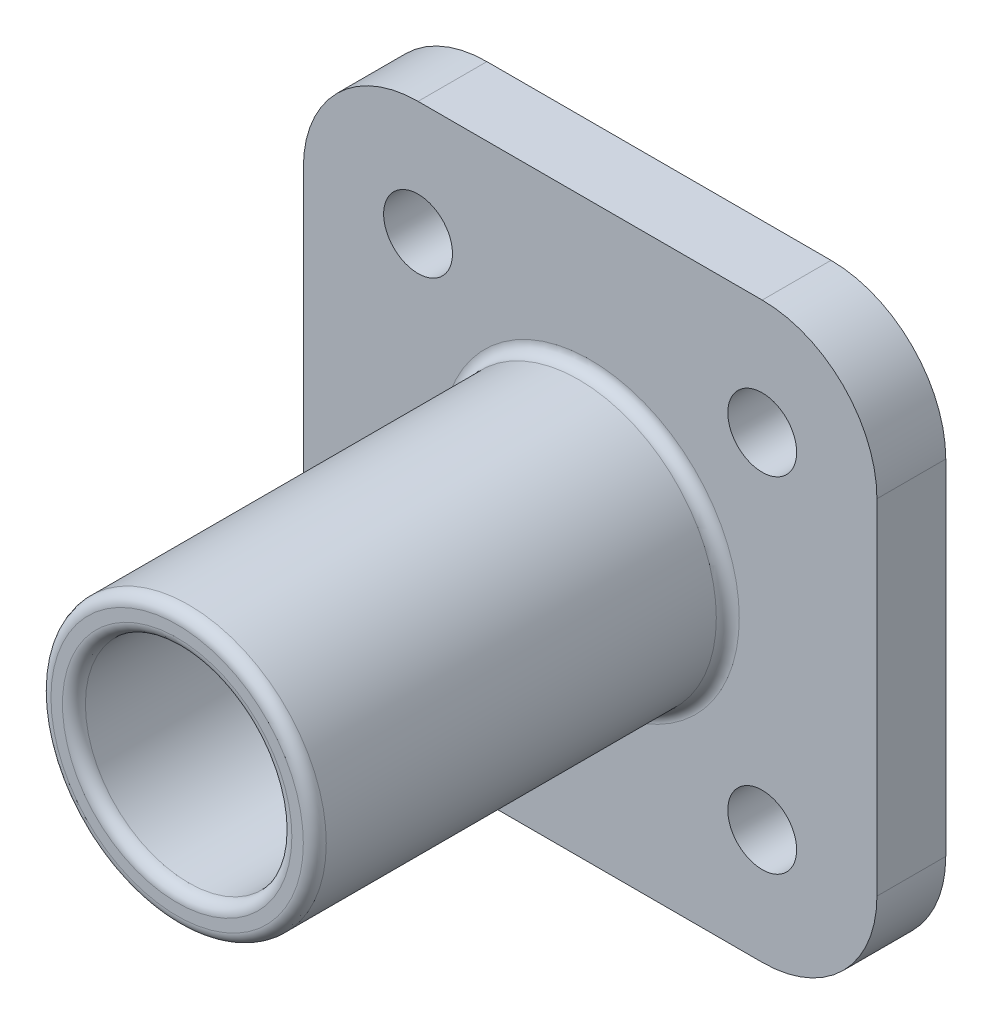
from build123d import *

# Parameters (mm, degrees)
ESQUISSE1_R        = 1.5
BOSS_EXTRU_1_DEPTH = 3
ESQUISSE2_R        = 6
ESQUISSE2_R_2      = 4.5
BOSS_EXTRU_2_DEPTH = 18
CONG_1_R           = 0.5


with BuildPart() as part:
    # Esquisse1 → Boss.-Extru.1 (new body)
    with BuildSketch(Plane.XY):
        with BuildLine():
            Line((7.5, -12.5), (-7.5, -12.5))
            ThreePointArc((-7.5, -12.5), (-11.035533906, -11.035533906), (-12.5, -7.5))
            Line((-12.5, -7.5), (-12.5, 7.5))
            ThreePointArc((-12.5, 7.5), (-11.035533906, 11.035533906), (-7.5, 12.5))
            Line((-7.5, 12.5), (7.5, 12.5))
            ThreePointArc((7.5, 12.5), (11.035533906, 11.035533906), (12.5, 7.5))
            Line((12.5, 7.5), (12.5, -7.5))
            ThreePointArc((12.5, -7.5), (11.035533906, -11.035533906), (7.5, -12.5))
        make_face()
        with Locations((-7.5, 7.5)):
            Circle(ESQUISSE1_R, mode=Mode.SUBTRACT)
        with Locations((7.5, 7.5)):
            Circle(ESQUISSE1_R, mode=Mode.SUBTRACT)
        with Locations((7.5, -7.5)):
            Circle(ESQUISSE1_R, mode=Mode.SUBTRACT)
        with Locations((-7.5, -7.5)):
            Circle(ESQUISSE1_R, mode=Mode.SUBTRACT)
    extrude(amount=BOSS_EXTRU_1_DEPTH)

    # Esquisse2 → Boss.-Extru.2 (add)
    with BuildSketch(Plane.XY.offset(3)):
        Circle(ESQUISSE2_R)
        Circle(ESQUISSE2_R_2, mode=Mode.SUBTRACT)
    extrude(amount=BOSS_EXTRU_2_DEPTH)

    # Congé1
    cong_1_edges = [part.edges().sort_by_distance(p)[0] for p in [
        (-6, 0, 3),
        (-6, 0, 21),
        (-4.5, 0, 21),
    ]]
    fillet(cong_1_edges, radius=CONG_1_R)


solid = part.part
